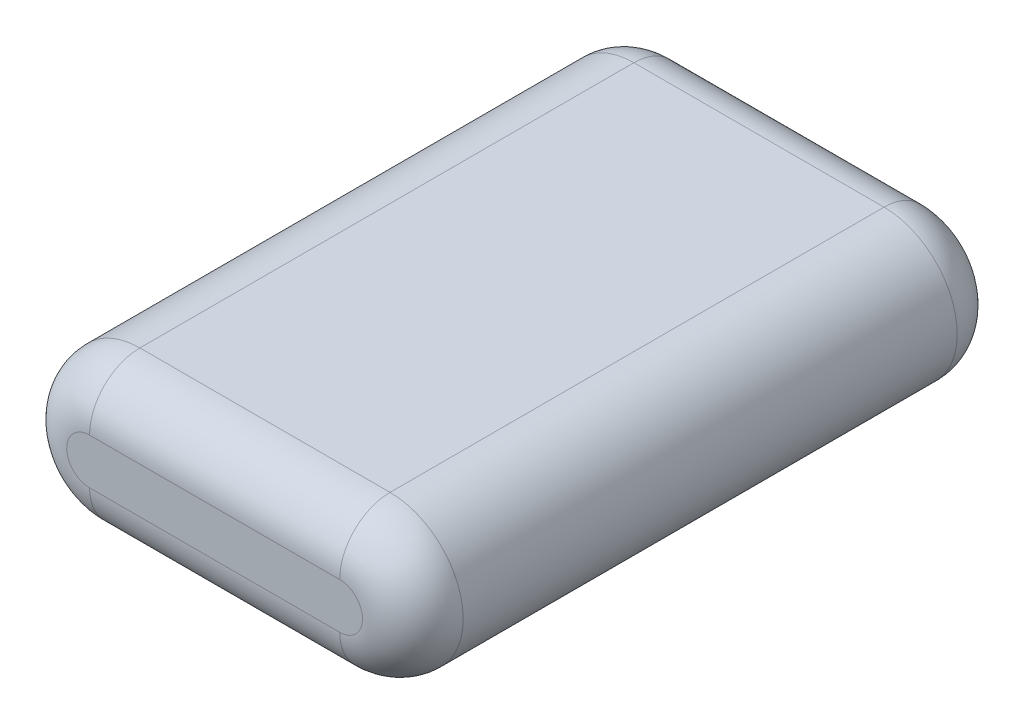
from build123d import *

# Parameters (mm, degrees)
BOSS_EXTRUDE1_DEPTH = 94.5
CUT_EXTRUDE1_DEPTH  = 1
CHAMFER3_SIZE       = 1.5
CHAMFER3_SIZE_2     = 1.050311307
SKETCH3_W           = 12.8
SKETCH3_H           = 5.35
CUT_EXTRUDE2_DEPTH  = 6
CUT_EXTRUDE3_DEPTH  = 6
CUT_EXTRUDE4_DEPTH  = 6
FILLET1_R           = 8


with BuildPart() as part:
    # Sketch1 → Boss-Extrude1 (new body)
    with BuildSketch(Plane.XY):
        with BuildLine():
            Line((19.875, 11.625), (-19.875, 11.625))
            ThreePointArc((-19.875, 11.625), (-31.5, 0), (-19.875, -11.625))
            Line((-19.875, -11.625), (19.875, -11.625))
            ThreePointArc((19.875, -11.625), (31.5, 0), (19.875, 11.625))
        make_face()
    extrude(amount=BOSS_EXTRUDE1_DEPTH)

    # Sketch2 → Cut-Extrude1 (cut)
    with BuildSketch(Plane(origin=(0, 0, 0), x_dir=(-1, 0, 0), z_dir=(0, 0, -1))):
        with BuildLine():
            Line((20.45, 6.05), (-20.45, 6.05))
            ThreePointArc((-20.45, 6.05), (-26.5, 0), (-20.45, -6.05))
            Line((-20.45, -6.05), (20.45, -6.05))
            ThreePointArc((20.45, -6.05), (26.5, 0), (20.45, 6.05))
        make_face()
    extrude(amount=-CUT_EXTRUDE1_DEPTH, mode=Mode.SUBTRACT)

    # Chamfer3
    # the kernel refuses this chamfer: 1.5, 1.050311307 mm, written as the material it takes off along each edge
    with BuildSketch(Plane(origin=(-20.45, 0, 0), x_dir=(0, -1, 0), z_dir=(1, 0, 0))) as chamfer3_piece_1_section:
        Polygon((6.05 + CHAMFER3_SIZE, 0), (6.05, -CHAMFER3_SIZE_2), (6.05, 0), align=None)
    chamfer3_piece_1 = revolve(axis=Axis((-20.45, 0, 0), (0, 0, -1)), revolution_arc=180, mode=Mode.PRIVATE)
    chamfer3_piece_1 = split(chamfer3_piece_1, bisect_by=Plane(origin=(-27.29545789, 0, 1), z_dir=(0, 0, -1)), keep=Keep.TOP, mode=Mode.PRIVATE)
    add(chamfer3_piece_1, mode=Mode.SUBTRACT)
    with BuildSketch(Plane(origin=(-20.45, 6.05, 0), x_dir=(0, 0.9997533347641299, -0.022209674198457065), z_dir=(1, 0, 0))) as chamfer3_piece_2_section:
        Polygon((CHAMFER3_SIZE * 0.999753334764, CHAMFER3_SIZE * 0.0222096741985), (-CHAMFER3_SIZE_2 * 0.0222096742051, CHAMFER3_SIZE_2 * 0.999753335064), (0, 0), align=None)
    chamfer3_piece_2 = extrude(amount=40.9, mode=Mode.PRIVATE)
    chamfer3_piece_2 = split(chamfer3_piece_2, bisect_by=Plane(origin=(0, 6.554046445, 1), z_dir=(0, 0, -1)), keep=Keep.TOP, mode=Mode.PRIVATE)
    add(chamfer3_piece_2, mode=Mode.SUBTRACT)
    with BuildSketch(Plane(origin=(20.45, -6.05, 0), x_dir=(0, -0.9997533347641299, -0.022209674198457065), z_dir=(-1, 0, 0))) as chamfer3_piece_3_section:
        Polygon((CHAMFER3_SIZE * 0.999753334764, CHAMFER3_SIZE * 0.0222096741985), (-CHAMFER3_SIZE_2 * 0.0222096742051, CHAMFER3_SIZE_2 * 0.999753335064), (0, 0), align=None)
    chamfer3_piece_3 = extrude(amount=40.9, mode=Mode.PRIVATE)
    chamfer3_piece_3 = split(chamfer3_piece_3, bisect_by=Plane(origin=(0, -6.554046445, 1), z_dir=(0, 0, -1)), keep=Keep.TOP, mode=Mode.PRIVATE)
    add(chamfer3_piece_3, mode=Mode.SUBTRACT)
    with BuildSketch(Plane(origin=(20.45, 0, 0), x_dir=(0, 1, 0), z_dir=(-1, 0, 0))) as chamfer3_piece_4_section:
        Polygon((6.05 + CHAMFER3_SIZE, 0), (6.05, -CHAMFER3_SIZE_2), (6.05, 0), align=None)
    chamfer3_piece_4 = revolve(axis=Axis((20.45, 0, 0), (0, 0, -1)), revolution_arc=180, mode=Mode.PRIVATE)
    chamfer3_piece_4 = split(chamfer3_piece_4, bisect_by=Plane(origin=(27.295457889, 0, 1), z_dir=(0, 0, -1)), keep=Keep.TOP, mode=Mode.PRIVATE)
    add(chamfer3_piece_4, mode=Mode.SUBTRACT)

    # Sketch3 → Cut-Extrude2 (cut)
    with BuildSketch(Plane(origin=(0, 0, 1), x_dir=(-1, 0, 0), z_dir=(0, 0, -1))):
        with Locations((-17.171851993, 0)):
            Rectangle(SKETCH3_W, SKETCH3_H)
        with Locations((17.171851993, 0)):
            Rectangle(SKETCH3_W, SKETCH3_H)
    extrude(amount=-CUT_EXTRUDE2_DEPTH, mode=Mode.SUBTRACT)

    # Sketch3<3> → Cut-Extrude3 (cut)
    with BuildSketch(Plane(origin=(0, 0, 1), x_dir=(-1, 0, 0), z_dir=(0, 0, -1))):
        Polygon((-3.45, -2.675), (3.45, -2.675), (3.45, -1.575), (2.7, -0.825), (-2.7, -0.825), (-3.45, -1.575), align=None)
    extrude(amount=-CUT_EXTRUDE3_DEPTH, mode=Mode.SUBTRACT)

    # Sketch3<4> → Cut-Extrude4 (cut)
    with BuildSketch(Plane(origin=(0, 0, 1), x_dir=(-1, 0, 0), z_dir=(0, 0, -1))):
        with BuildLine():
            Line((-2.85, 1.735925997), (2.85, 1.735925997))
            ThreePointArc((2.85, 1.735925997), (4.175, 3.060925997), (2.85, 4.385925997))
            Line((2.85, 4.385925997), (-2.85, 4.385925997))
            ThreePointArc((-2.85, 4.385925997), (-4.175, 3.060925997), (-2.85, 1.735925997))
        make_face()
    extrude(amount=-CUT_EXTRUDE4_DEPTH, mode=Mode.SUBTRACT)

    # Fillet1
    # the kernel refuses this fillet: 8 mm, written as the material it takes off along each edge
    with BuildSketch(Plane(origin=(19.875, 0, 0), x_dir=(0, -1, 0), z_dir=(-1, 0, 0))) as fillet1_piece_1:
        with BuildLine():
            CenterArc((11.625 - FILLET1_R, FILLET1_R), FILLET1_R, 270, 90)
            Line((11.625 - FILLET1_R, 0), (11.625, 0))
            Line((11.625, 0), (11.625, FILLET1_R))
        make_face()
    revolve(axis=Axis((19.875, 0, 0), (0, 0, 1)), revolution_arc=180, mode=Mode.SUBTRACT)
    with BuildSketch(Plane(origin=(-19.875, -11.625, 0), x_dir=(0, 0, 1), z_dir=(1, 0, 0)), Plane(origin=(19.875, 11.625, 94.5), x_dir=(0, -1, 0), z_dir=(-1, 0, 0))) as fillet1_piece_2:
        with BuildLine():
            CenterArc((FILLET1_R, -FILLET1_R), FILLET1_R, 90, 90)
            Line((0, -FILLET1_R), (0, 0))
            Line((0, 0), (FILLET1_R, 0))
        make_face()
    extrude(amount=39.75, mode=Mode.SUBTRACT)
    with BuildSketch(Plane(origin=(-19.875, 0, 0), x_dir=(0, 1, 0), z_dir=(1, 0, 0))) as fillet1_piece_3:
        with BuildLine():
            CenterArc((11.625 - FILLET1_R, FILLET1_R), FILLET1_R, 270, 90)
            Line((11.625 - FILLET1_R, 0), (11.625, 0))
            Line((11.625, 0), (11.625, FILLET1_R))
        make_face()
    revolve(axis=Axis((-19.875, 0, 0), (0, 0, 1)), revolution_arc=180, mode=Mode.SUBTRACT)
    with BuildSketch(Plane(origin=(19.875, 0, 94.5), x_dir=(0, -1, 0), z_dir=(-1, 0, 0))) as fillet1_piece_4:
        with BuildLine():
            CenterArc((11.625 - FILLET1_R, -FILLET1_R), FILLET1_R, 0, 90)
            Line((11.625 - FILLET1_R, 0), (11.625, 0))
            Line((11.625, 0), (11.625, -FILLET1_R))
        make_face()
    revolve(axis=Axis((19.875, 0, 94.5), (0, 0, 1)), revolution_arc=180, mode=Mode.SUBTRACT)
    with BuildSketch(Plane(origin=(-19.875, -11.625, 94.5), x_dir=(0, 0, -1), z_dir=(1, 0, 0)), Plane(origin=(19.875, 11.625, 0), x_dir=(0, -1, 0), z_dir=(-1, 0, 0))) as fillet1_piece_5:
        with BuildLine():
            CenterArc((FILLET1_R, FILLET1_R), FILLET1_R, 180, 90)
            Line((0, FILLET1_R), (0, 0))
            Line((0, 0), (FILLET1_R, 0))
        make_face()
    extrude(amount=39.75, mode=Mode.SUBTRACT)
    with BuildSketch(Plane(origin=(-19.875, 0, 94.5), x_dir=(0, 1, 0), z_dir=(1, 0, 0))) as fillet1_piece_6:
        with BuildLine():
            CenterArc((11.625 - FILLET1_R, -FILLET1_R), FILLET1_R, 0, 90)
            Line((11.625 - FILLET1_R, 0), (11.625, 0))
            Line((11.625, 0), (11.625, -FILLET1_R))
        make_face()
    revolve(axis=Axis((-19.875, 0, 94.5), (0, 0, 1)), revolution_arc=180, mode=Mode.SUBTRACT)


solid = part.part
